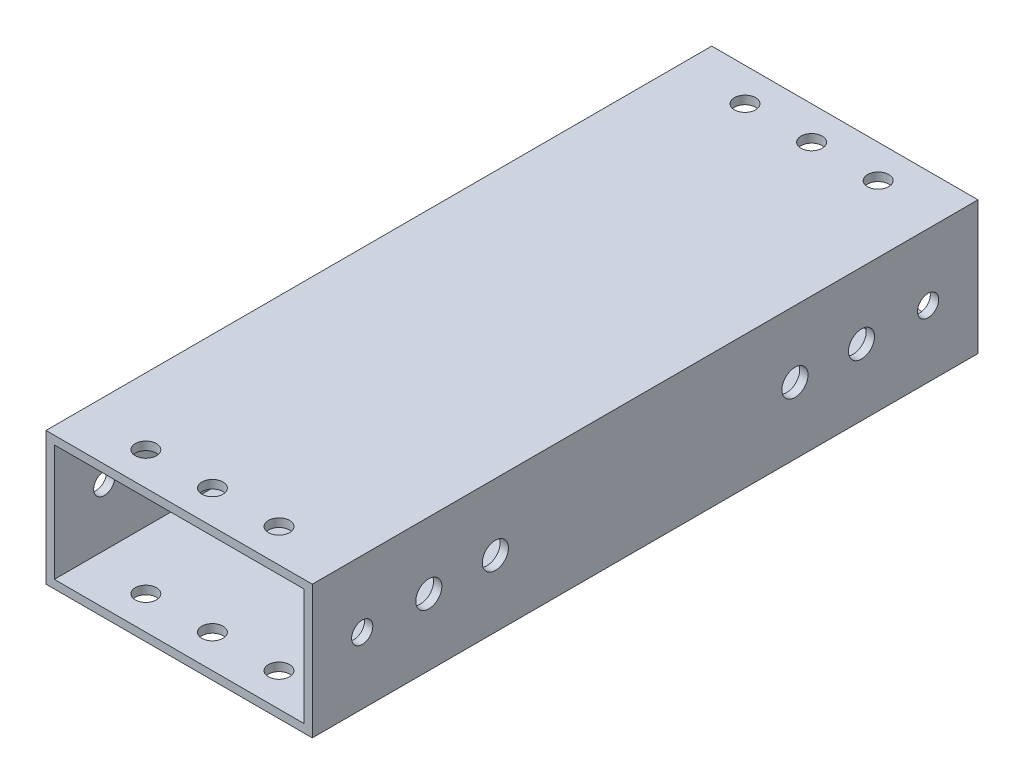
from build123d import *

# Parameters (mm, degrees)
SKETCH1_W           = 50.8
SKETCH1_H           = 25.4
SKETCH1_W_2         = 47.625
SKETCH1_H_2         = 22.225
BOSS_EXTRUDE1_DEPTH = 63.5
SKETCH2_R           = 2.0193
CUT_EXTRUDE1_DEPTH  = 73.955945611
SKETCH3_R           = 2.0193
SKETCH3_R_2         = 2.4892
CUT_EXTRUDE2_DEPTH  = 83.30540687


with BuildPart() as part:
    # Sketch1 → Boss-Extrude1 (new, symmetric)
    with BuildSketch(Plane.XY):
        Rectangle(SKETCH1_W, SKETCH1_H)
        Rectangle(SKETCH1_W_2, SKETCH1_H_2, mode=Mode.SUBTRACT)
    extrude(amount=BOSS_EXTRUDE1_DEPTH, both=True)

    # Sketch2 → Cut-Extrude1 (cut, through all)
    with BuildSketch(Plane(origin=(0, 12.7, 0), x_dir=(1, 0, 0), z_dir=(0, 1, 0))):
        with Locations((-12.7, 57.15)):
            Circle(SKETCH2_R)
        with Locations((0, 57.15)):
            Circle(SKETCH2_R)
        with Locations((12.7, 57.15)):
            Circle(SKETCH2_R)
        with Locations((12.7, -57.15)):
            Circle(SKETCH2_R)
        with Locations((0, -57.15)):
            Circle(SKETCH2_R)
        with Locations((-12.7, -57.15)):
            Circle(SKETCH2_R)
    extrude(amount=-CUT_EXTRUDE1_DEPTH, mode=Mode.SUBTRACT)

    # Sketch3 → Cut-Extrude2 (cut, through all)
    with BuildSketch(Plane(origin=(25.4, 0, 0), x_dir=(0, 0, -1), z_dir=(1, 0, 0))):
        with Locations((-53.975, 0)):
            Circle(SKETCH3_R)
        with Locations((53.975, 0)):
            Circle(SKETCH3_R)
        with Locations((-41.275, 0)):
            Circle(SKETCH3_R_2)
        with Locations((-28.575, 0)):
            Circle(SKETCH3_R_2)
        with Locations((28.575, 0)):
            Circle(SKETCH3_R_2)
        with Locations((41.275, 0)):
            Circle(SKETCH3_R_2)
    extrude(amount=-CUT_EXTRUDE2_DEPTH, mode=Mode.SUBTRACT)


solid = part.part
